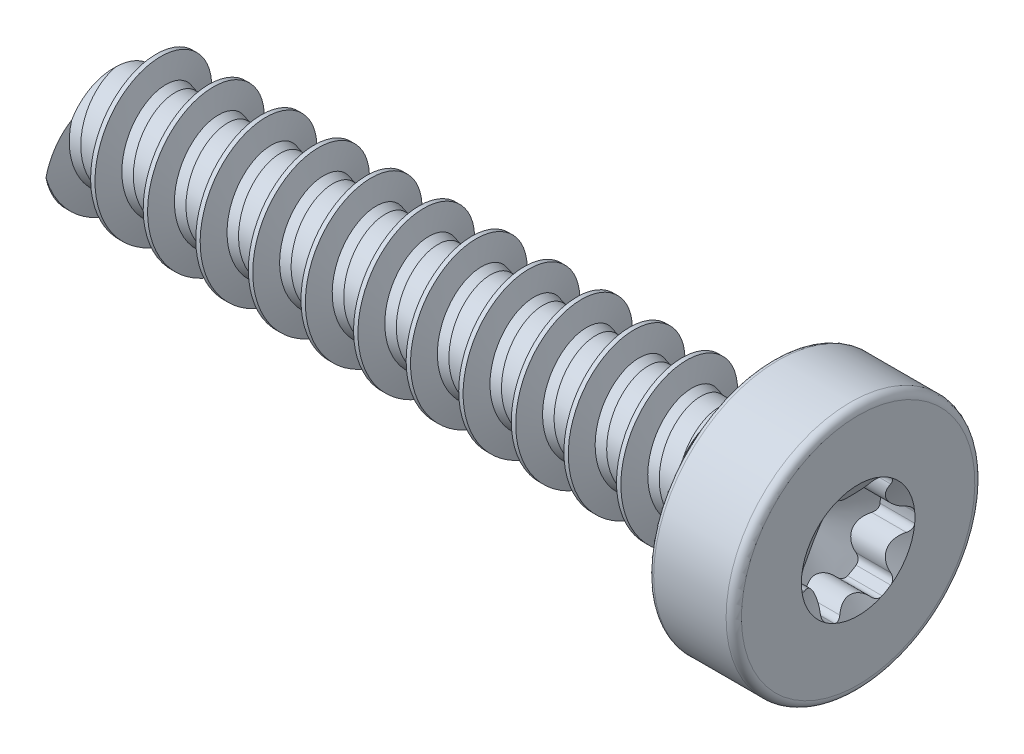
from build123d import *

# Parameters (mm, degrees)
BOSS_EXTRUDE1_REACH = 38.857
SKETCH3_R           = 5.636768
SKETCH9_W           = 29.21
SKETCH9_H           = 3.429
CUT_SWEEP1_PITCH    = 2.54


# Read off the part's stored shape, not the designer's step: Split1
with BuildPart() as part:
    # Sketch2 → Revolve1 (revolve)
    with BuildSketch(Plane.XY):
        with BuildLine():
            Line((-17.9324, 0), (17.9324, 0))
            Line((17.9324, 0), (17.9324, 5.636768))
            ThreePointArc((17.9324, 5.636768), (17.823932268, 5.898632268), (17.562068, 6.0071))
            Line((17.562068, 6.0071), (14.064488, 6.0071))
            ThreePointArc((14.064488, 6.0071), (13.889911821, 5.934788179), (13.8176, 5.760212))
            Line((13.8176, 5.760212), (13.8176, 3.126147333))
            ThreePointArc((13.8176, 3.126147333), (13.600664537, 2.602418796), (13.076936, 2.385483333))
            Line((13.076936, 2.385483333), (11.672575377, 2.385483333))
            Line((11.672575377, 2.385483333), (11.2776, 2.27965))
            Line((11.2776, 2.27965), (-17.9324, 2.27965))
            Line((-17.9324, 2.27965), (-17.9324, 0))
        make_face()
    revolve(axis=Axis((-17.9324, 0, 0), (-1, 0, 0)))

    # Sketch12 → Cut-Revolve3 (revolve, cut)
    with BuildSketch(Plane.XY, mode=Mode.PRIVATE) as cut_revolve3_sk:
        Polygon((17.9324, 2.7432), (16.2607625, 2.7432), (14.676975242, 0), (17.9324, 0), align=None)
    revolve(cut_revolve3_sk.sketch.rotate(Axis((-17.9324, 0, 0), (1, 0, 0)), 90), axis=Axis((-17.9324, 0, 0), (1, 0, 0)), mode=Mode.SUBTRACT)

    # Boss-Extrude1: up to this cone (the profile starts inside it)
    boss_extrude1_end = Plane(origin=(17.9324, 0, 0), z_dir=(1, 0, 0)).offset(-3.255423758) * Cone(1.732e-06, 83.573158991, 48.25098484, align=(Align.CENTER, Align.CENTER, Align.MIN), mode=Mode.PRIVATE)
    # Sketch3 → Boss-Extrude1 (add, up to the surface)
    with BuildSketch(Plane(origin=(17.9324, 0, 0), x_dir=(0, 0, -1), z_dir=(1, 0, 0)), mode=Mode.PRIVATE) as boss_extrude1_sk1:
        Circle(SKETCH3_R)
        with BuildLine():
            ThreePointArc((1.3716, 2.375680888), (1.266668796, 2.433248118), (1.159326416, 2.486183521))
            ThreePointArc((1.159326416, 2.486183521), (0.943496566, 2.510897702), (0.756129528, 2.40095723))
            ThreePointArc((0.756129528, 2.40095723), (0, 2.0574), (-0.756129528, 2.40095723))
            ThreePointArc((-0.756129528, 2.40095723), (-0.943496566, 2.510897702), (-1.159326416, 2.486183521))
            ThreePointArc((-1.159326416, 2.486183521), (-1.266668796, 2.433248118), (-1.3716, 2.375680888))
            ThreePointArc((-1.3716, 2.375680888), (-1.473920286, 2.313591414), (-1.57343488, 2.247097888))
            ThreePointArc((-1.57343488, 2.247097888), (-1.702752913, 2.072540846), (-1.70122519, 1.855305994))
            ThreePointArc((-1.70122519, 1.855305994), (-1.781760666, 1.0287), (-2.457354718, 0.545651235))
            ThreePointArc((-2.457354718, 0.545651235), (-2.646249479, 0.438356856), (-2.732761296, 0.239085634))
            ThreePointArc((-2.732761296, 0.239085634), (-2.740589081, 0.119656703), (-2.7432, 0))
            ThreePointArc((-2.7432, 0), (-2.740589081, -0.119656703), (-2.732761296, -0.239085634))
            ThreePointArc((-2.732761296, -0.239085634), (-2.646249479, -0.438356856), (-2.457354718, -0.545651235))
            ThreePointArc((-2.457354718, -0.545651235), (-1.781760666, -1.0287), (-1.70122519, -1.855305994))
            ThreePointArc((-1.70122519, -1.855305994), (-1.702752913, -2.072540846), (-1.57343488, -2.247097888))
            ThreePointArc((-1.57343488, -2.247097888), (-1.473920286, -2.313591414), (-1.3716, -2.375680888))
            ThreePointArc((-1.3716, -2.375680888), (-1.266668796, -2.433248118), (-1.159326416, -2.486183521))
            ThreePointArc((-1.159326416, -2.486183521), (-0.943496566, -2.510897702), (-0.756129528, -2.40095723))
            ThreePointArc((-0.756129528, -2.40095723), (0, -2.0574), (0.756129528, -2.40095723))
            ThreePointArc((0.756129528, -2.40095723), (0.943496566, -2.510897702), (1.159326416, -2.486183521))
            ThreePointArc((1.159326416, -2.486183521), (1.266668796, -2.433248118), (1.3716, -2.375680888))
            ThreePointArc((1.3716, -2.375680888), (1.473920286, -2.313591414), (1.57343488, -2.247097888))
            ThreePointArc((1.57343488, -2.247097888), (1.702752913, -2.072540846), (1.70122519, -1.855305994))
            ThreePointArc((1.70122519, -1.855305994), (1.781760666, -1.0287), (2.457354718, -0.545651235))
            ThreePointArc((2.457354718, -0.545651235), (2.646249479, -0.438356856), (2.732761296, -0.239085634))
            ThreePointArc((2.732761296, -0.239085634), (2.740589081, -0.119656703), (2.7432, 0))
            ThreePointArc((2.7432, 0), (2.740589081, 0.119656703), (2.732761296, 0.239085634))
            ThreePointArc((2.732761296, 0.239085634), (2.646249479, 0.438356856), (2.457354718, 0.545651235))
            ThreePointArc((2.457354718, 0.545651235), (1.781760666, 1.0287), (1.70122519, 1.855305994))
            ThreePointArc((1.70122519, 1.855305994), (1.702752913, 2.072540846), (1.57343488, 2.247097888))
            ThreePointArc((1.57343488, 2.247097888), (1.473920286, 2.313591414), (1.3716, 2.375680888))
        make_face(mode=Mode.SUBTRACT)
    boss_extrude1_tool1 = extrude(boss_extrude1_sk1.sketch, amount=-BOSS_EXTRUDE1_REACH, mode=Mode.PRIVATE) & boss_extrude1_end
    add(boss_extrude1_tool1.solids().sort_by_distance((17.9324, 0, 5.477336))[0])

    # Cut-Extrude2 cone 1 section (through the dimple's axis) → Cut-Extrude2 (revolve, cut)
    with BuildSketch(Plane(origin=(17.9324, 0, 0), x_dir=(0, 0, -1), z_dir=(0, 1, 0))):
        Polygon((0, 0), (2.7432, 0), (0, 1.583787258), align=None)
    revolve(axis=Axis((17.9324, 0, 0), (-1, 0, 0)), mode=Mode.SUBTRACT)

    # Split1 outline → Split1 (revolve, cut)
    with BuildSketch(Plane.YX):
        Polygon((2.27965, -17.9324), (2.27965, 11.2776), (0, 2.769830377), (0, -17.9324), align=None)
    revolve(axis=Axis((0, 0, 0), (1, 0, 0)), mode=Mode.SUBTRACT)


with BuildPart() as body_2:
    # Split1 2 outline → Split1 2 (revolve)
    with BuildSketch(Plane.YX):
        Polygon((2.27965, -17.9324), (2.27965, 11.2776), (0, 2.769830377), (0, -17.9324), align=None)
    revolve(axis=Axis((0, 0, 0), (1, 0, 0)))

    # Sketch9 → Revolve2 (revolve)
    with BuildSketch(Plane.XY):
        with Locations((-3.3274, 1.7145)):
            Rectangle(SKETCH9_W, SKETCH9_H)
    revolve(axis=Axis((-17.9324, 0, 0), (1, 0, 0)))

    # Cut-Sweep1: the profile of Sketch7 screwed along a right-hand helix of 13.5 turns, 10 arcs to a turn; built about Z, then put on its axis
    cut_sweep1_z = Axis((0, 0, 0), (0, 0, 1))
    cut_sweep1_corners = [(3.429, 0, -0.928160865), (2.397581527, 0, -1.204528612), (2.27965, 0, -1.644655064), (2.27965, 0, -2.54), (2.397581527, 0, -2.980126452), (3.429, 0, -3.256494199), (3.703963066, 0, -3.256494199), (3.703963066, 0, -0.928160865)]
    with BuildLine(mode=Mode.PRIVATE) as cut_sweep1_profile:
        Line(cut_sweep1_corners[0], cut_sweep1_corners[1])
        Line(cut_sweep1_corners[1], cut_sweep1_corners[2])
        Line(cut_sweep1_corners[2], cut_sweep1_corners[3])
        Line(cut_sweep1_corners[3], cut_sweep1_corners[4])
        Line(cut_sweep1_corners[4], cut_sweep1_corners[5])
        Line(cut_sweep1_corners[5], cut_sweep1_corners[6])
        Line(cut_sweep1_corners[6], cut_sweep1_corners[7])
        Line(cut_sweep1_corners[7], cut_sweep1_corners[0])
    cut_sweep1_cap = Face(cut_sweep1_profile.wire())
    cut_sweep1_turn_angles = [0, 18, 36, 54, 72, 90, 108, 126, 144, 162, 180, 198, 216, 234, 252, 270, 288, 306, 324, 342, 360]
    cut_sweep1_turn_weights = [1, 0.9510565162951535, 1, 0.9510565162951535, 1, 0.9510565162951535, 1, 0.9510565162951535, 1, 0.9510565162951535, 1, 0.9510565162951535, 1, 0.9510565162951535, 1, 0.9510565162951535, 1, 0.9510565162951535, 1, 0.9510565162951535, 1]
    cut_sweep1_turn_rails = [Edge.make_bspline([Vector(p[0], p[1], 0).rotate(cut_sweep1_z, cut_sweep1_turn_angles[k]) / cut_sweep1_turn_weights[k] + Vector(0, 0, p[2] + CUT_SWEEP1_PITCH * cut_sweep1_turn_angles[k] / 360) for k in range(21)], [0, 0, 0, 1, 1, 2, 2, 3, 3, 4, 4, 5, 5, 6, 6, 7, 7, 8, 8, 9, 9, 10, 10, 10], 2, cut_sweep1_turn_weights) for p in cut_sweep1_corners]
    cut_sweep1_turn_sides = [Face.make_surface_from_curves(cut_sweep1_turn_rails[p[0]], cut_sweep1_turn_rails[p[1]]) for p in [(0, 1), (1, 2), (2, 3), (3, 4), (4, 5), (5, 6), (6, 7), (7, 0)]]
    cut_sweep1_last_angles = [4680, 4698, 4716, 4734, 4752, 4770, 4788, 4806, 4824, 4842, 4860]
    cut_sweep1_last_weights = [1, 0.9510565162951535, 1, 0.9510565162951535, 1, 0.9510565162951535, 1, 0.9510565162951535, 1, 0.951056516295129, 1]
    cut_sweep1_last_rails = [Edge.make_bspline([Vector(p[0], p[1], 0).rotate(cut_sweep1_z, cut_sweep1_last_angles[k]) / cut_sweep1_last_weights[k] + Vector(0, 0, p[2] + CUT_SWEEP1_PITCH * cut_sweep1_last_angles[k] / 360) for k in range(11)], [0, 0, 0, 1, 1, 2, 2, 3, 3, 4, 4, 5, 5, 5], 2, cut_sweep1_last_weights) for p in cut_sweep1_corners]
    cut_sweep1_last_sides = [Face.make_surface_from_curves(cut_sweep1_last_rails[p[0]], cut_sweep1_last_rails[p[1]]) for p in [(0, 1), (1, 2), (2, 3), (3, 4), (4, 5), (5, 6), (6, 7), (7, 0)]]
    cut_sweep1 = Plane(origin=(-17.9324, 0, 0), x_dir=(0, 1, 0), z_dir=(1, 0, 0)) * Solid(Shell([*[p.moved(Location((0, 0, CUT_SWEEP1_PITCH * i))) for i in range(13) for p in cut_sweep1_turn_sides], *cut_sweep1_last_sides, cut_sweep1_cap, cut_sweep1_cap.rotate(cut_sweep1_z, 4860).moved(Location((0, 0, CUT_SWEEP1_PITCH * 4860 / 360)))]))
    add(cut_sweep1, mode=Mode.SUBTRACT)

    # Sketch11 → Cut-Revolve2 (revolve, cut)
    with BuildSketch(Plane.XY):
        Polygon((11.2776, 2.27965), (10.969632596, 3.429), (11.2776, 3.429), align=None)
    revolve(axis=Axis((-17.9324, 0, 0), (1, 0, 0)), mode=Mode.SUBTRACT)

    # Combine1: union part
    add(part.part)


solid = body_2.part
